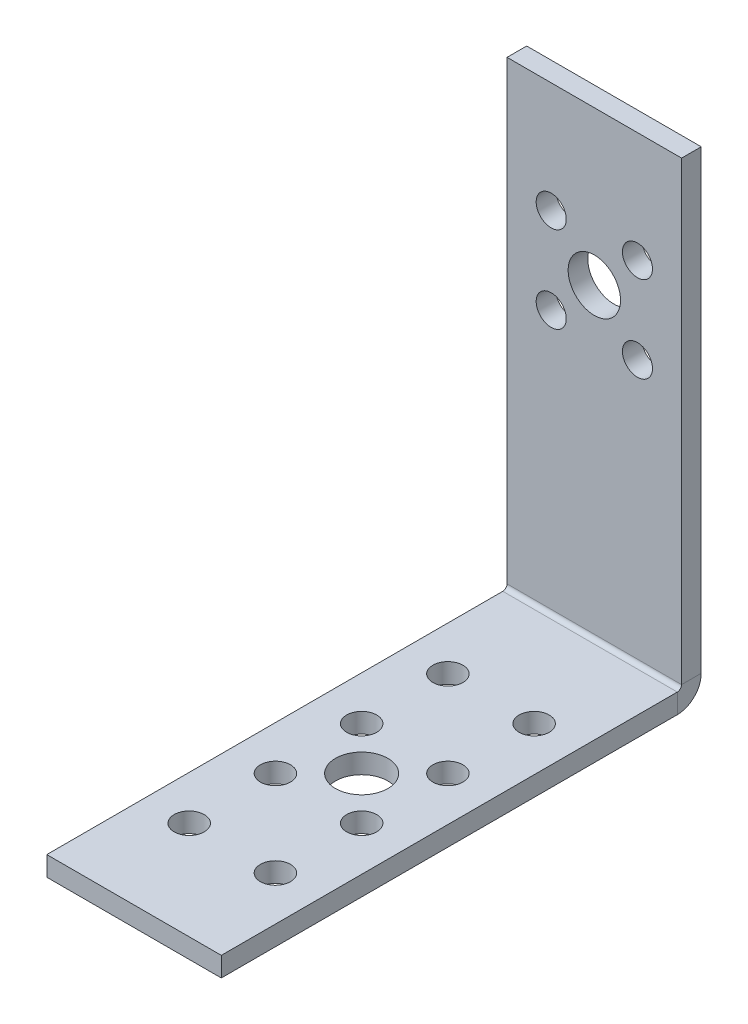
from build123d import *

# Parameters (mm, degrees)
SKETCH1_W                    = 20.32
SKETCH1_H                    = 55.88
BASE_FLANGE1_DEPTH           = 2.286
EDGE_FLANGE1_STRIP_W         = 10.144
EDGE_FLANGE1_STRIP_H         = 2.286
EDGE_FLANGE1_STRIP_CUT_DEPTH = 20.32
EDGE_FLANGE1_DEPTH           = 20.32
SKETCH9_R                    = 3.05
CUT_EXTRUDE1_DEPTH           = 79.090440106
SKETCH10_R                   = 3.05
SKETCH10_R_2                 = 1.75
CUT_EXTRUDE2_DEPTH           = 62.287731529


# Sheet-metal steps are written as plain solids
with BuildPart() as part:
    # Sketch1 → Base-Flange1 (new body)
    with BuildSketch(Plane(origin=(0, 0, 0), x_dir=(1, 0, 0), z_dir=(0, 1, 0))):
        Rectangle(SKETCH1_W, SKETCH1_H)
    extrude(amount=-BASE_FLANGE1_DEPTH)

    # Edge-Flange1 strip (across the edge) → Edge-Flange1 strip cut (cut)
    with BuildSketch(Plane(origin=(10.16, 0, -27.94), x_dir=(0, 0, 1), z_dir=(-1, 0, 0))):
        with Locations((-2.286, -1.143)):
            Rectangle(EDGE_FLANGE1_STRIP_W, EDGE_FLANGE1_STRIP_H)
    extrude(amount=EDGE_FLANGE1_STRIP_CUT_DEPTH, mode=Mode.SUBTRACT)

    # Edge-Flange1 section (across the edge) → Edge-Flange1 (add)
    with BuildSketch(Plane(origin=(10.16, 0, -27.94), x_dir=(0, 0, 1), z_dir=(-1, 0, 0))):
        with BuildLine():
            Line((0, 0.5), (0, 53.594))
            Line((0, 53.594), (2.286, 53.594))
            Line((2.286, 53.594), (2.286, 0.5))
            ThreePointArc((2.286, 0.5), (2.432446609, 0.146446609), (2.786, 0))
            Line((2.786, 0), (2.786, -2.286))
            ThreePointArc((2.786, -2.286), (0.816000508, -1.469999492), (0, 0.5))
        make_face()
    extrude(amount=EDGE_FLANGE1_DEPTH)

    # Sketch9 → Cut-Extrude1 (cut, through all)
    with BuildSketch(Plane(origin=(0, 0, -27.94), x_dir=(-1, 0, 0), z_dir=(0, 0, -1))):
        with Locations(Location((0, 35.695518005, 0), (0, 0, 90))):
            Circle(SKETCH9_R)
        with BuildLine():
            ThreePointArc((-5.020458146, 42.465976152), (-6.770458146, 40.715976152), (-5.020458146, 38.965976152))
            ThreePointArc((-5.020458146, 38.965976152), (-3.270458146, 40.715976152), (-5.020458146, 42.465976152))
        make_face()
        with BuildLine():
            ThreePointArc((-5.020458146, 32.425059859), (-6.770458146, 30.675059859), (-5.020458146, 28.925059859))
            ThreePointArc((-5.020458146, 28.925059859), (-3.270458146, 30.675059859), (-5.020458146, 32.425059859))
        make_face()
        with BuildLine():
            ThreePointArc((5.020458146, 32.425059859), (3.270458146, 30.675059859), (5.020458146, 28.925059859))
            ThreePointArc((5.020458146, 28.925059859), (6.770458146, 30.675059859), (5.020458146, 32.425059859))
        make_face()
        with BuildLine():
            ThreePointArc((5.020458146, 42.465976152), (3.270458146, 40.715976152), (5.020458146, 38.965976152))
            ThreePointArc((5.020458146, 38.965976152), (6.770458146, 40.715976152), (5.020458146, 42.465976152))
        make_face()
    extrude(amount=-CUT_EXTRUDE1_DEPTH, mode=Mode.SUBTRACT)

    # Sketch10 → Cut-Extrude2 (cut, through all)
    with BuildSketch(Plane(origin=(0, 0, 0), x_dir=(1, 0, 0), z_dir=(0, 1, 0))):
        with Locations(Location((-0.01000002, -1.426000002, 0), (0, 0, 270))):
            Circle(SKETCH10_R)
        with Locations(Location((-5.030458167, -16.487374441, 0), (0, 0, 270))):
            Circle(SKETCH10_R_2)
        with Locations(Location((-5.030458167, 3.594458144, 0), (0, 0, 270))):
            Circle(SKETCH10_R_2)
        with Locations(Location((5.010458126, 13.635374437, 0), (0, 0, 270))):
            Circle(SKETCH10_R_2)
        with Locations(Location((5.010458126, -6.446458149, 0), (0, 0, 270))):
            Circle(SKETCH10_R_2)
        with Locations(Location((5.010458126, -16.487374441, 0), (0, 0, 270))):
            Circle(SKETCH10_R_2)
        with Locations(Location((-5.030458167, 13.635374437, 0), (0, 0, 270))):
            Circle(SKETCH10_R_2)
        with Locations(Location((-5.030458167, -6.446458149, 0), (0, 0, 270))):
            Circle(SKETCH10_R_2)
        with Locations(Location((5.010458126, 3.594458144, 0), (0, 0, 270))):
            Circle(SKETCH10_R_2)
    extrude(amount=-CUT_EXTRUDE2_DEPTH, mode=Mode.SUBTRACT)


solid = part.part
